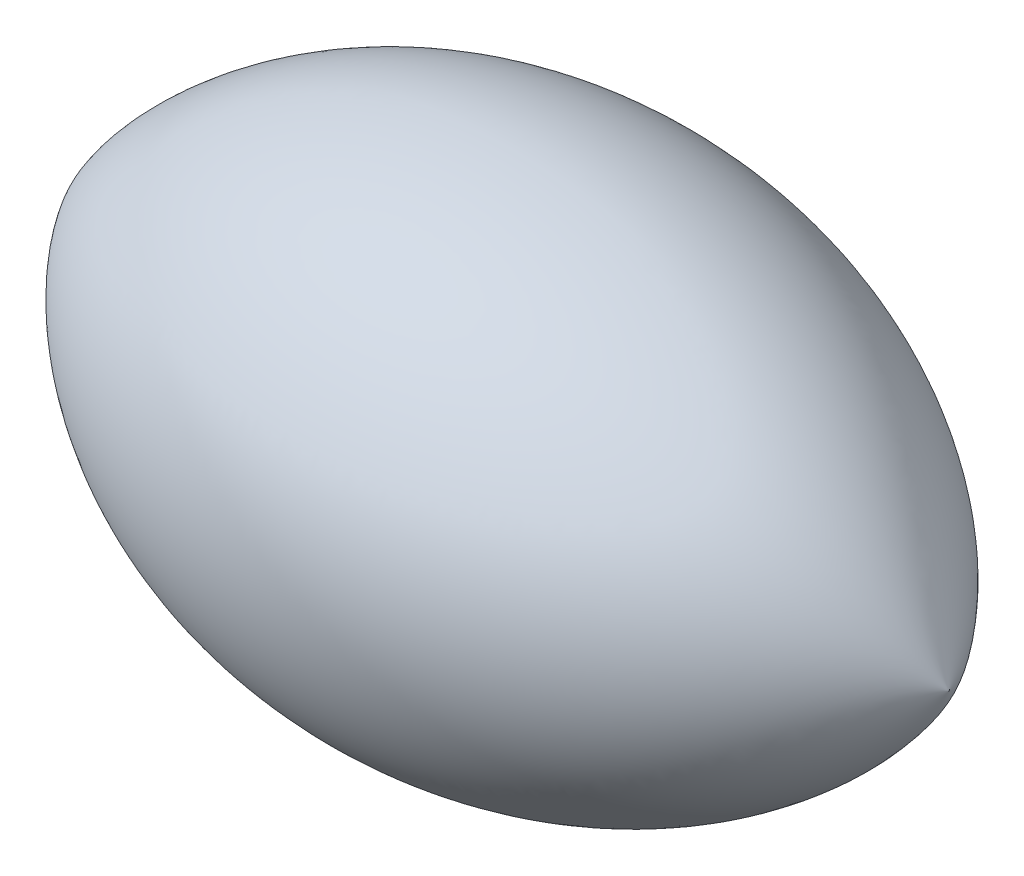
from build123d import *


with BuildPart() as part:
    # Sketch1 → Revolve1 (revolve)
    with BuildSketch(Plane.XY):
        with BuildLine():
            Line((-349.340329321, 146.602737459), (368.052724522, 146.602737459))
            add(Edge.make_bspline(
                [(-349.340329321, 146.602737459), (-206.694300634, 425.181402521), (224.023246236, 421.138231356), (368.052724522, 146.602737459)],
                knots=[0, 0, 0, 0, 1, 1, 1, 1], degree=3))
        make_face()
    revolve(axis=Axis((-349.340329321, 146.602737459, 0), (1, 0, 0)))


solid = part.part
